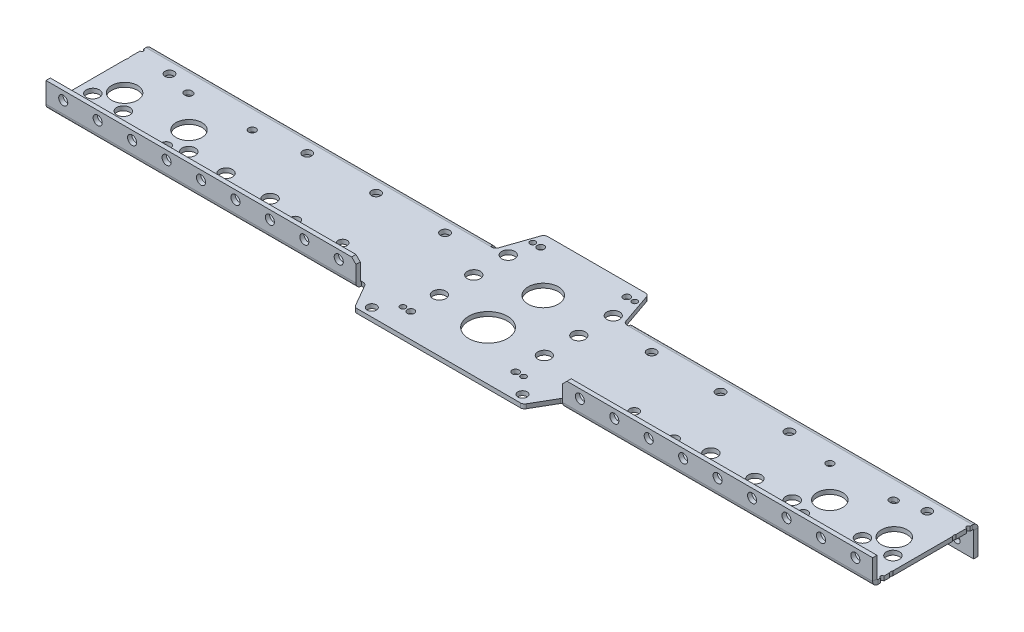
from build123d import *

# Parameters (mm, degrees)
SKETCH1_W                      = 812.8
SKETCH1_H                      = 69.85
BOSS_EXTRUDE1_DEPTH            = 3.175
SKETCH3_R                      = 14.2875
CUT_EXTRUDE1_DEPTH             = 816.802024467
EDGE_FLANGE1_DEPTH             = 812.8
EDGE_FLANGE2_DEPTH             = 812.8
SKETCH10_R                     = 4.826
LONG_6WD_DEPTH                 = 817.444922817
SKETCH11_R                     = 4.826
SHORT_6WD_DEPTH                = 817.444922817
SKETCH12_R                     = 3.3528
F_8WD_EGG_DEPTH                = 817.444922817
SKETCH13_R                     = 3.3528
LOWER_CHURRO_DEPTH             = 817.444922817
SKETCH14_R                     = 2.667
UPPER_FLANGE_HP_DEPTH          = 817.729920277
SKETCH16_R                     = 3.3528
LOWER_FLANGE_HP_DEPTH          = 817.433889486
LPATTERN1_COUNT                = 32
LPATTERN1_PITCH                = 25.4
SKETCH17_W                     = 152.4
SKETCH17_H                     = 6.35
CUT_EXTRUDE9_DEPTH             = 818.031193633
SKETCH18_W                     = 146.05
SKETCH18_H                     = 3.175
BOSS_EXTRUDE2_DEPTH            = 19.05
SKETCH19_W                     = 101.6
SKETCH19_H                     = 3.937
CUT_EXTRUDE10_DEPTH            = 818.031193633
SKETCH20_W                     = 95.25
SKETCH20_H                     = 3.175
BOSS_EXTRUDE3_DEPTH            = 27.432
CUT_EXTRUDE14_DEPTH            = 819.902667079
SKETCH21_R                     = 11.1125
SKETCH21_R_2                   = 4.7625
SKETCH21_R_3                   = 2.54
SKETCH21_R_4                   = 2.032
TB_MINI_SHAFT_PLATE_DEPTH      = 819.8226487
CUT_EXTRUDE12_DEPTH            = 819.8226487
SKETCH23_R                     = 3.3528
UPPER_INTERNAL_CHIRRO_HP_DEPTH = 819.8226487
SKETCH24_R                     = 1.27
CUTTING_GUIDES_DEPTH           = 819.8226487
SKETCH26_R                     = 3.4036
SONIC_MOUNTING_HOLES_DEPTH     = 819.902667079
SKETCH25_R                     = 9.525
SKETCH25_R_2                   = 2.667
MECANUM_LONG_DEPTH             = 3.175
FILLET1_R                      = 3.175
CHAMFER1_SIZE                  = 3.175
SKETCH29_R                     = 9.525
SKETCH29_R_2                   = 2.667
CUT_EXTRUDE15_DEPTH            = 819.902667079
CUT_EXTRUDE16_DEPTH            = 819.902667079
CUT_EXTRUDE16_DEPTH_BACK       = 819.902667079
SKETCH30_OUTSIDE_W             = 979.194
SKETCH30_OUTSIDE_H             = 282.726
SKETCH30_OUTSIDE_W_2           = 609.6
SKETCH30_OUTSIDE_H_2           = 205.411421364


# Sheet-metal steps are written as plain solids
with BuildPart() as part:
    # Sketch1 → Boss-Extrude1 (new body)
    with BuildSketch(Plane(origin=(0, 0, 0), x_dir=(1, 0, 0), z_dir=(0, 1, 0))):
        with Locations((406.4, 34.925)):
            Rectangle(SKETCH1_W, SKETCH1_H)
    extrude(amount=BOSS_EXTRUDE1_DEPTH)

    # Sketch3 → Cut-Extrude1 (cut, through all)
    with BuildSketch(Plane(origin=(0, 3.175, 0), x_dir=(1, 0, 0), z_dir=(0, 1, 0))):
        with Locations(Location((406.4, 17.272, 0), (0, 0, 270))):
            Circle(SKETCH3_R)
    extrude(amount=-CUT_EXTRUDE1_DEPTH, mode=Mode.SUBTRACT)

    # Edge-Flange1 section (across the edge) → Edge-Flange1 (add)
    with BuildSketch(Plane(origin=(0, 3.175, 0.762), x_dir=(0, 0, -1), z_dir=(1, 0, 0))):
        with BuildLine():
            Line((-3.175, 0.762), (-3.175, 15.875))
            Line((-3.175, 15.875), (0, 15.875))
            Line((0, 15.875), (0, 0.762))
            ThreePointArc((0, 0.762), (0.223184633, 0.223184633), (0.762, 0))
            Line((0.762, 0), (0.762, -3.175))
            ThreePointArc((0.762, -3.175), (-2.021879398, -2.021879398), (-3.175, 0.762))
        make_face()
    extrude(amount=EDGE_FLANGE1_DEPTH)

    # Edge-Flange2 section (across the edge) → Edge-Flange2 (add)
    with BuildSketch(Plane(origin=(0, 0, -70.612), x_dir=(0, 0, 1), z_dir=(1, 0, 0))):
        with BuildLine():
            Line((-3.175, 0.762), (-3.175, 19.05))
            Line((-3.175, 19.05), (0, 19.05))
            Line((0, 19.05), (0, 0.762))
            ThreePointArc((0, 0.762), (0.223184633, 0.223184633), (0.762, 0))
            Line((0.762, 0), (0.762, -3.175))
            ThreePointArc((0.762, -3.175), (-2.021879398, -2.021879398), (-3.175, 0.762))
        make_face()
    extrude(amount=EDGE_FLANGE2_DEPTH)

    # Sketch10 → Long 6wd (cut, through all)
    with BuildSketch(Plane(origin=(0, 3.175, 0), x_dir=(1, 0, 0), z_dir=(0, 1, 0))):
        with Locations(Location((86.339113657, 20.828, 0), (0, 0, 270))):
            Circle(SKETCH10_R)
        with Locations(Location((111.349627997, 20.828, 0), (0, 0, 270))):
            Circle(SKETCH10_R)
        with Locations(Location((133.855797334, 20.828, 0), (0, 0, 270))):
            Circle(SKETCH10_R)
        with Locations(Location((726.460886343, 20.828, 0), (0, 0, 270))):
            Circle(SKETCH10_R)
        with Locations(Location((701.450372003, 20.828, 0), (0, 0, 270))):
            Circle(SKETCH10_R)
        with Locations(Location((678.944202666, 20.828, 0), (0, 0, 270))):
            Circle(SKETCH10_R)
    extrude(amount=-LONG_6WD_DEPTH, mode=Mode.SUBTRACT)

    # Sketch11 → Short 6wd (cut, through all)
    with BuildSketch(Plane(origin=(0, 3.175, 0), x_dir=(1, 0, 0), z_dir=(0, 1, 0))):
        with Locations(Location((183.852302373, 19.05, 0), (0, 0, 270))):
            Circle(SKETCH11_R)
        with Locations(Location((211.361504088, 19.05, 0), (0, 0, 270))):
            Circle(SKETCH11_R)
        with Locations(Location((243.875125248, 19.05, 0), (0, 0, 270))):
            Circle(SKETCH11_R)
        with Locations(Location((568.924874752, 19.05, 0), (0, 0, 270))):
            Circle(SKETCH11_R)
        with Locations(Location((601.438495912, 19.05, 0), (0, 0, 270))):
            Circle(SKETCH11_R)
        with Locations(Location((628.947697627, 19.05, 0), (0, 0, 270))):
            Circle(SKETCH11_R)
    extrude(amount=-SHORT_6WD_DEPTH, mode=Mode.SUBTRACT)

    # Sketch12 → 8wd egg (cut, through all)
    with BuildSketch(Plane(origin=(0, 3.175, 0), x_dir=(1, 0, 0), z_dir=(0, 1, 0))):
        with Locations(Location((298.874532383, 17.547282407, 0), (0, 0, 270))):
            Circle(SKETCH12_R)
        with Locations(Location((513.925467617, 17.547282407, 0), (0, 0, 270))):
            Circle(SKETCH12_R)
    extrude(amount=-F_8WD_EGG_DEPTH, mode=Mode.SUBTRACT)

    # Sketch13 → lower churro (cut, through all)
    with BuildSketch(Plane(origin=(0, 3.175, 0), x_dir=(1, 0, 0), z_dir=(0, 1, 0))):
        with Locations(Location((171.45, 14.732, 0), (0, 0, 270))):
            Circle(SKETCH13_R)
        with Locations(Location((266.7, 14.732, 0), (0, 0, 270))):
            Circle(SKETCH13_R)
        with Locations(Location((546.1, 14.732, 0), (0, 0, 270))):
            Circle(SKETCH13_R)
        with Locations(Location((641.35, 14.732, 0), (0, 0, 270))):
            Circle(SKETCH13_R)
    extrude(amount=-LOWER_CHURRO_DEPTH, mode=Mode.SUBTRACT)

    # Sketch14 → upper flange HP (cut, through all)
    with BuildSketch(Plane(origin=(0, 0, -73.787), x_dir=(-1, 0, 0), z_dir=(0, 0, -1))):
        with Locations(Location((-12.7, -12.7, 0), (0, 0, 90))):
            Circle(SKETCH14_R)
        with Locations(Location((-38.1, -12.7, 0), (0, 0, 90))):
            Circle(SKETCH14_R)
        with Locations(Location((-63.5, -12.7, 0), (0, 0, 90))):
            Circle(SKETCH14_R)
        with Locations(Location((-88.9, -12.7, 0), (0, 0, 90))):
            Circle(SKETCH14_R)
        with Locations(Location((-114.3, -12.7, 0), (0, 0, 90))):
            Circle(SKETCH14_R)
        with Locations(Location((-139.7, -12.7, 0), (0, 0, 90))):
            Circle(SKETCH14_R)
        with Locations(Location((-165.1, -12.7, 0), (0, 0, 90))):
            Circle(SKETCH14_R)
        with Locations(Location((-190.5, -12.7, 0), (0, 0, 90))):
            Circle(SKETCH14_R)
        with Locations(Location((-215.9, -12.7, 0), (0, 0, 90))):
            Circle(SKETCH14_R)
        with Locations(Location((-241.3, -12.7, 0), (0, 0, 90))):
            Circle(SKETCH14_R)
        with Locations(Location((-266.7, -12.7, 0), (0, 0, 90))):
            Circle(SKETCH14_R)
        with Locations(Location((-292.1, -12.7, 0), (0, 0, 90))):
            Circle(SKETCH14_R)
        with Locations(Location((-317.5, -12.7, 0), (0, 0, 90))):
            Circle(SKETCH14_R)
        with Locations(Location((-342.9, -12.7, 0), (0, 0, 90))):
            Circle(SKETCH14_R)
        with Locations(Location((-368.3, -12.7, 0), (0, 0, 90))):
            Circle(SKETCH14_R)
        with Locations(Location((-393.7, -12.7, 0), (0, 0, 90))):
            Circle(SKETCH14_R)
        with Locations(Location((-419.1, -12.7, 0), (0, 0, 90))):
            Circle(SKETCH14_R)
        with Locations(Location((-444.5, -12.7, 0), (0, 0, 90))):
            Circle(SKETCH14_R)
        with Locations(Location((-469.9, -12.7, 0), (0, 0, 90))):
            Circle(SKETCH14_R)
        with Locations(Location((-495.3, -12.7, 0), (0, 0, 90))):
            Circle(SKETCH14_R)
        with Locations(Location((-520.7, -12.7, 0), (0, 0, 90))):
            Circle(SKETCH14_R)
        with Locations(Location((-546.1, -12.7, 0), (0, 0, 90))):
            Circle(SKETCH14_R)
        with Locations(Location((-571.5, -12.7, 0), (0, 0, 90))):
            Circle(SKETCH14_R)
        with Locations(Location((-596.9, -12.7, 0), (0, 0, 90))):
            Circle(SKETCH14_R)
        with Locations(Location((-622.3, -12.7, 0), (0, 0, 90))):
            Circle(SKETCH14_R)
        with Locations(Location((-647.7, -12.7, 0), (0, 0, 90))):
            Circle(SKETCH14_R)
        with Locations(Location((-673.1, -12.7, 0), (0, 0, 90))):
            Circle(SKETCH14_R)
        with Locations(Location((-698.5, -12.7, 0), (0, 0, 90))):
            Circle(SKETCH14_R)
        with Locations(Location((-723.9, -12.7, 0), (0, 0, 90))):
            Circle(SKETCH14_R)
        with Locations(Location((-749.3, -12.7, 0), (0, 0, 90))):
            Circle(SKETCH14_R)
        with Locations(Location((-774.7, -12.7, 0), (0, 0, 90))):
            Circle(SKETCH14_R)
        with Locations(Location((-800.1, -12.7, 0), (0, 0, 90))):
            Circle(SKETCH14_R)
    extrude(amount=-UPPER_FLANGE_HP_DEPTH, mode=Mode.SUBTRACT)

    # Sketch16 → Lower flange HP (cut, through all)
    with BuildSketch(Plane(origin=(0, 0, 0.762), x_dir=(-1, 0, 0), z_dir=(0, 0, -1))):
        with Locations(Location((-12.7, 12.7, 0), (0, 0, 90))):
            Circle(SKETCH16_R)
    lower_flange_hp = extrude(amount=-LOWER_FLANGE_HP_DEPTH, mode=Mode.SUBTRACT)

    # LPattern1: Lower flange HP ×32
    with Locations(*[(i * LPATTERN1_PITCH, 0, 0) for i in range(1, LPATTERN1_COUNT)]):
        add(lower_flange_hp, mode=Mode.SUBTRACT)

    # Sketch17 → Cut-Extrude9 (cut, through all)
    with BuildSketch(Plane(origin=(0, 19.05, 0), x_dir=(1, 0, 0), z_dir=(0, 1, 0))):
        with Locations((406.4, -3.175)):
            Rectangle(SKETCH17_W, SKETCH17_H)
    extrude(amount=-CUT_EXTRUDE9_DEPTH, mode=Mode.SUBTRACT)

    # Sketch18 → Boss-Extrude2 (add)
    with BuildSketch(Plane.XY):
        with Locations((406.4, 1.5875)):
            Rectangle(SKETCH18_W, SKETCH18_H)
    extrude(amount=BOSS_EXTRUDE2_DEPTH)

    # Sketch19 → Cut-Extrude10 (cut, through all)
    with BuildSketch(Plane.XZ.offset(19.05)):
        with Locations((406.4, -71.8185)):
            Rectangle(SKETCH19_W, SKETCH19_H)
    extrude(amount=-CUT_EXTRUDE10_DEPTH, mode=Mode.SUBTRACT)

    # Sketch20 → Boss-Extrude3 (add)
    with BuildSketch(Plane(origin=(0, 0, -69.85), x_dir=(-1, 0, 0), z_dir=(0, 0, -1))):
        with Locations((-406.4, 1.5875)):
            Rectangle(SKETCH20_W, SKETCH20_H)
    extrude(amount=BOSS_EXTRUDE3_DEPTH)

    # Sketch27 → Cut-Extrude14 (cut, through all)
    with BuildSketch(Plane(origin=(0, 3.175, 0), x_dir=(1, 0, 0), z_dir=(0, 1, 0))):
        Polygon((333.375, 0), (344.373522628, -19.05), (333.375, -19.05), align=None)
        Polygon((479.425, 0), (479.425, -19.05), (468.426477372, -19.05), align=None)
    extrude(amount=-CUT_EXTRUDE14_DEPTH, mode=Mode.SUBTRACT)

    # Sketch21 → TB Mini Shaft plate (cut, through all)
    with BuildSketch(Plane.XZ):
        with Locations(Location((406.4, -57.9628, 0), (0, 0, 270))):
            Circle(SKETCH21_R)
        with Locations(Location((445.12429721, -45.466, 0), (0, 0, 270))):
            Circle(SKETCH21_R_2)
        with Locations(Location((367.67570279, -45.466, 0), (0, 0, 270))):
            Circle(SKETCH21_R_2)
        with Locations(Location((445.12429721, -70.866, 0), (0, 0, 270))):
            Circle(SKETCH21_R_2)
        with Locations(Location((445.12429721, -20.066, 0), (0, 0, 270))):
            Circle(SKETCH21_R_2)
        with Locations(Location((367.67570279, -20.066, 0), (0, 0, 270))):
            Circle(SKETCH21_R_2)
        with Locations(Location((367.67570279, -70.866, 0), (0, 0, 270))):
            Circle(SKETCH21_R_2)
        with Locations(Location((438.15, -87.85352, 0), (0, 0, 270))):
            Circle(SKETCH21_R_3)
        with Locations(Location((374.65, -87.85352, 0), (0, 0, 270))):
            Circle(SKETCH21_R_3)
        with Locations(Location((443.992, -87.85352, 0), (0, 0, 270))):
            Circle(SKETCH21_R_4)
        with Locations(Location((368.808, -87.85352, 0), (0, 0, 270))):
            Circle(SKETCH21_R_4)
        with Locations(Location((445.0461, 1.03886, 0), (0, 0, 270))):
            Circle(SKETCH21_R_3)
        with Locations(Location((367.7539, 1.03886, 0), (0, 0, 270))):
            Circle(SKETCH21_R_3)
        with Locations(Location((361.9119, 1.03886, 0), (0, 0, 270))):
            Circle(SKETCH21_R_4)
        with Locations(Location((450.8881, 1.03886, 0), (0, 0, 270))):
            Circle(SKETCH21_R_4)
    extrude(amount=-TB_MINI_SHAFT_PLATE_DEPTH, mode=Mode.SUBTRACT)

    # Sketch22 → Cut-Extrude12 (cut, through all)
    with BuildSketch(Plane.XZ):
        Polygon((454.025, -69.85), (444.579404912, -97.282), (454.025, -97.282), align=None)
        Polygon((358.775, -69.85), (368.220595088, -97.282), (358.775, -97.282), align=None)
    extrude(amount=-CUT_EXTRUDE12_DEPTH, mode=Mode.SUBTRACT)

    # Sketch23 → Upper internal chirro HP (cut, through all)
    with BuildSketch(Plane.XZ):
        with Locations(Location((330.2, -61.722, 0), (0, 0, 270))):
            Circle(SKETCH23_R)
        with Locations(Location((279.4, -61.722, 0), (0, 0, 270))):
            Circle(SKETCH23_R)
        with Locations(Location((228.6, -61.722, 0), (0, 0, 270))):
            Circle(SKETCH23_R)
        with Locations(Location((127, -61.722, 0), (0, 0, 270))):
            Circle(SKETCH23_R)
        with Locations(Location((25.4, -61.722, 0), (0, 0, 270))):
            Circle(SKETCH23_R)
        with Locations(Location((482.6, -61.722, 0), (0, 0, 270))):
            Circle(SKETCH23_R)
        with Locations(Location((533.4, -61.722, 0), (0, 0, 270))):
            Circle(SKETCH23_R)
        with Locations(Location((584.2, -61.722, 0), (0, 0, 270))):
            Circle(SKETCH23_R)
        with Locations(Location((685.8, -61.722, 0), (0, 0, 270))):
            Circle(SKETCH23_R)
        with Locations(Location((787.4, -61.722, 0), (0, 0, 270))):
            Circle(SKETCH23_R)
        with Locations(Location((6.35, -39.497, 0), (0, 0, 270))):
            Circle(SKETCH23_R)
        with Locations(Location((806.45, -39.497, 0), (0, 0, 270))):
            Circle(SKETCH23_R)
    extrude(amount=-UPPER_INTERNAL_CHIRRO_HP_DEPTH, mode=Mode.SUBTRACT)

    # Sketch24 → Cutting guides (cut, through all)
    with BuildSketch(Plane.XZ):
        with Locations(Location((101.6, -3.175, 0), (0, 0, 270))):
            Circle(SKETCH24_R)
        with Locations(Location((101.6, -66.675, 0), (0, 0, 270))):
            Circle(SKETCH24_R)
        with Locations(Location((50.8, -66.675, 0), (0, 0, 270))):
            Circle(SKETCH24_R)
        with Locations(Location((50.8, -3.175, 0), (0, 0, 270))):
            Circle(SKETCH24_R)
        with Locations(Location((762, -66.675, 0), (0, 0, 270))):
            Circle(SKETCH24_R)
        with Locations(Location((762, -3.175, 0), (0, 0, 270))):
            Circle(SKETCH24_R)
        with Locations(Location((711.2, -3.175, 0), (0, 0, 270))):
            Circle(SKETCH24_R)
        with Locations(Location((711.2, -66.675, 0), (0, 0, 270))):
            Circle(SKETCH24_R)
    extrude(amount=-CUTTING_GUIDES_DEPTH, mode=Mode.SUBTRACT)

    # Sketch26 → Sonic mounting holes (cut, through all)
    with BuildSketch(Plane(origin=(0, 3.175, 0), x_dir=(1, 0, 0), z_dir=(0, 1, 0))):
        with Locations(Location((350.8375, -12.8905, 0), (0, 0, 270))):
            Circle(SKETCH26_R)
        with Locations(Location((461.9625, -12.8905, 0), (0, 0, 270))):
            Circle(SKETCH26_R)
    extrude(amount=-SONIC_MOUNTING_HOLES_DEPTH, mode=Mode.SUBTRACT)

    # Sketch25 → mecanum long (cut)
    with BuildSketch(Plane(origin=(0, 3.175, 0), x_dir=(1, 0, 0), z_dir=(0, 1, 0))):
        with Locations(Location((690.197287335, 33.02, 0), (0, 0, 270))):
            Circle(SKETCH25_R)
        with Locations(Location((713.545953249, 9.671334085, 0), (0, 0, 90))):
            Circle(SKETCH25_R_2)
        with Locations(Location((713.545953249, 56.368665915, 0), (0, 0, 90))):
            Circle(SKETCH25_R_2)
        with Locations(Location((666.84862142, 56.368665915, 0), (0, 0, 270))):
            Circle(SKETCH25_R_2)
        with Locations(Location((666.84862142, 9.671334085, 0), (0, 0, 270))):
            Circle(SKETCH25_R_2)
        with Locations(Location((99.254046751, 56.368665915, 0), (0, 0, 270))):
            Circle(SKETCH25_R_2)
        with Locations(Location((99.254046751, 9.671334085, 0), (0, 0, 270))):
            Circle(SKETCH25_R_2)
        with Locations(Location((145.95137858, 9.671334085, 0), (0, 0, 90))):
            Circle(SKETCH25_R_2)
        with Locations(Location((145.95137858, 56.368665915, 0), (0, 0, 90))):
            Circle(SKETCH25_R_2)
        with Locations(Location((122.602712665, 33.02, 0), (0, 0, 90))):
            Circle(SKETCH25_R)
    extrude(amount=-MECANUM_LONG_DEPTH, mode=Mode.SUBTRACT)

    # Fillet1
    fillet1_edges = [part.edges().sort_by_distance(p)[0] for p in [
        (333.375, 1.5875, 0),
        (479.425, 1.5875, 0),
        (454.025, 1.5875, -69.85),
        (358.775, 1.5875, -69.85),
        (468.426477372, 1.5875, 19.05),
        (344.373522628, 1.5875, 19.05),
        (368.220595088, 1.5875, -97.282),
        (444.579404912, 1.5875, -97.282),
    ]]
    fillet(fillet1_edges, radius=FILLET1_R)

    # Chamfer1
    chamfer1_edges = [part.edges().sort_by_distance(p)[0] for p in [
        (0, 19.05, 2.3495),
        (812.8, 19.05, 2.3495),
        (482.6, 19.05, 2.3495),
        (330.2, 19.05, 2.3495),
        (0, -19.05, -72.1995),
        (812.8, -19.05, -72.1995),
        (355.6, -19.05, -72.1995),
        (457.2, -19.05, -72.1995),
    ]]
    chamfer(chamfer1_edges, length=CHAMFER1_SIZE)

    # Sketch29 → Cut-Extrude15 (cut, through all)
    with BuildSketch(Plane(origin=(0, 3.175, 0), x_dir=(1, 0, 0), z_dir=(0, 1, 0))):
        with Locations(Location((642.712889143, 33.02, 0), (0, 0, 90))):
            Circle(SKETCH29_R)
        with Locations(Location((619.364223229, 56.368665915, 0), (0, 0, 90))):
            Circle(SKETCH29_R_2)
        with Locations((666.061555058, 56.368665915)):
            Circle(SKETCH29_R_2)
        with Locations((666.061555058, 9.671334085)):
            Circle(SKETCH29_R_2)
        with Locations(Location((619.364223229, 9.671334085, 0), (0, 0, 90))):
            Circle(SKETCH29_R_2)
        with Locations(Location((193.435776771, 56.368665915, 0), (0, 0, 90))):
            Circle(SKETCH29_R_2)
        with Locations((146.738444942, 56.368665915)):
            Circle(SKETCH29_R_2)
        with Locations(Location((170.087110857, 33.02, 0), (0, 0, 90))):
            Circle(SKETCH29_R)
        with Locations((146.738444942, 9.671334085)):
            Circle(SKETCH29_R_2)
        with Locations(Location((193.435776771, 9.671334085, 0), (0, 0, 90))):
            Circle(SKETCH29_R_2)
    extrude(amount=-CUT_EXTRUDE15_DEPTH, mode=Mode.SUBTRACT)

    # Sketch30 outside → Cut-Extrude16 (cut, two sides: drawn at the far end of the back side and taken through both)
    with BuildSketch(Plane(origin=(0, 3.175, 0), x_dir=(1, 0, 0), z_dir=(0, 1, 0)).offset(-CUT_EXTRUDE16_DEPTH_BACK)):
        with Locations((406.4, 39.116)):
            Rectangle(SKETCH30_OUTSIDE_W, SKETCH30_OUTSIDE_H)
        with Locations((406.4, 20.837865048)):
            Rectangle(SKETCH30_OUTSIDE_W_2, SKETCH30_OUTSIDE_H_2, mode=Mode.SUBTRACT)
    extrude(amount=CUT_EXTRUDE16_DEPTH + CUT_EXTRUDE16_DEPTH_BACK, mode=Mode.SUBTRACT)


solid = part.part
